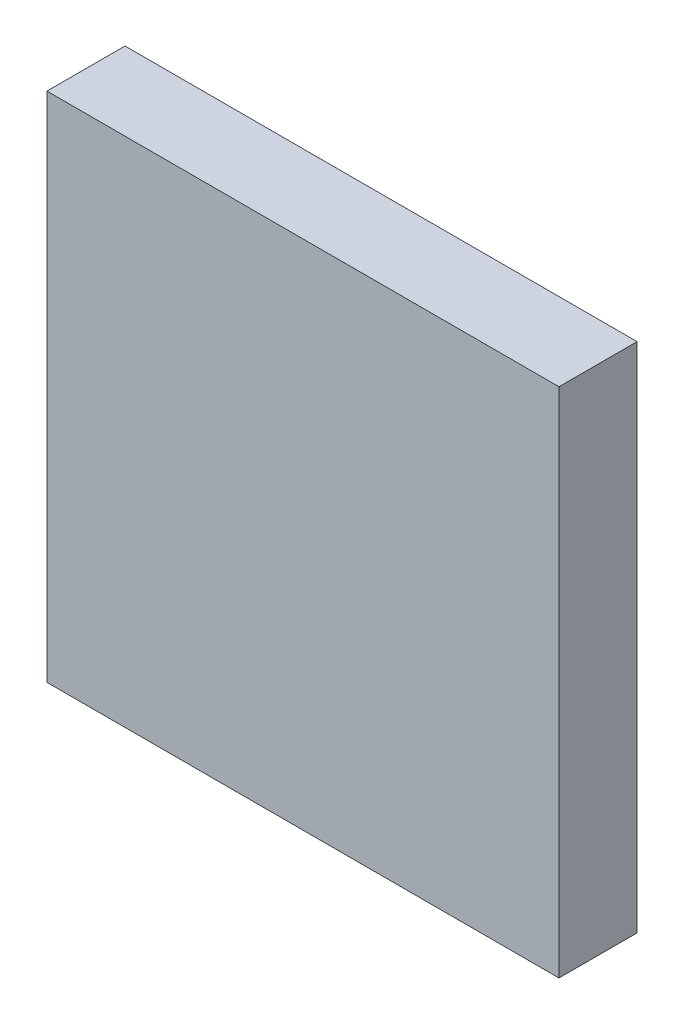
from build123d import *

# Parameters (mm, degrees)
THICKEN1_START       = -150.815
THICKEN1_DEPTH       = 301.63
THICKEN1_2_OUTLINE_W = 298.63
THICKEN1_2_OUTLINE_H = 44.5
THICKEN1_2_DEPTH     = 1.5
THICKEN1_START_2     = 149.315
THICKEN1_3_OUTLINE_W = 298.63
THICKEN1_3_OUTLINE_H = 44.5
THICKEN1_3_DEPTH     = 1.5
CUT_EXTRUDE1_DEPTH   = 3.5
CUT_EXTRUDE2_DEPTH   = 44.5


# Read off the part's stored shape, not the designer's step: Thicken1
with BuildPart() as part:
    # Thicken1 outline → Thicken1 (new body)
    with BuildSketch(Plane(origin=(0, 0, 0), x_dir=(1, 0, 0), z_dir=(0, 1, 0)).offset(THICKEN1_START)):
        Polygon((-150.815, -46), (150.815, -46), (150.815, 0), (149.315, 0), (149.315, -44.5), (-149.315, -44.5), (-149.315, 0), (-150.815, 0), align=None)
    extrude(amount=THICKEN1_DEPTH)

    # Thicken1 2 outline → Thicken1 2 (add)
    with BuildSketch(Plane(origin=(0, 0, 0), x_dir=(1, 0, 0), z_dir=(0, 1, 0)).offset(THICKEN1_START)):
        with Locations((0, -22.25)):
            Rectangle(THICKEN1_2_OUTLINE_W, THICKEN1_2_OUTLINE_H)
    extrude(amount=THICKEN1_2_DEPTH)

    # Thicken1 3 outline → Thicken1 3 (add)
    with BuildSketch(Plane(origin=(0, 0, 0), x_dir=(1, 0, 0), z_dir=(0, 1, 0)).offset(THICKEN1_START_2)):
        with Locations((0, -22.25)):
            Rectangle(THICKEN1_3_OUTLINE_W, THICKEN1_3_OUTLINE_H)
    extrude(amount=THICKEN1_3_DEPTH)

    # Sketch2 → Cut-Extrude1 (cut)
    with BuildSketch(Plane.XY):
        Polygon((147.166053391, -70.458946609), (145.751839828, -71.873160172), (148.8125, -74.933820344), (148.8125, -139.691179656), (139.691179656, -148.8125), (74.933820344, -148.8125), (71.873160172, -145.751839828), (70.458946609, -147.166053391), (74.105393219, -150.8125), (140.519606781, -150.8125), (150.8125, -140.519606781), (150.8125, -74.105393219), align=None)
    extrude(amount=CUT_EXTRUDE1_DEPTH, mode=Mode.SUBTRACT)

    # Sketch3 → Cut-Extrude2 (cut)
    with BuildSketch(Plane.XY):
        with BuildLine():
            Line((73.180697047, -143.737196171), (70.140927125, -146.776966094))
            Line((70.140927125, -146.776966094), (73.115800859, -149.751839828))
            Line((73.115800859, -149.751839828), (75.655768509, -149.751839828))
            ThreePointArc((75.655768509, -149.751839828), (76.458227012, -145.905044907), (73.180697047, -143.737196171))
        make_face()
    extrude(amount=CUT_EXTRUDE2_DEPTH, mode=Mode.SUBTRACT)


solid = part.part
